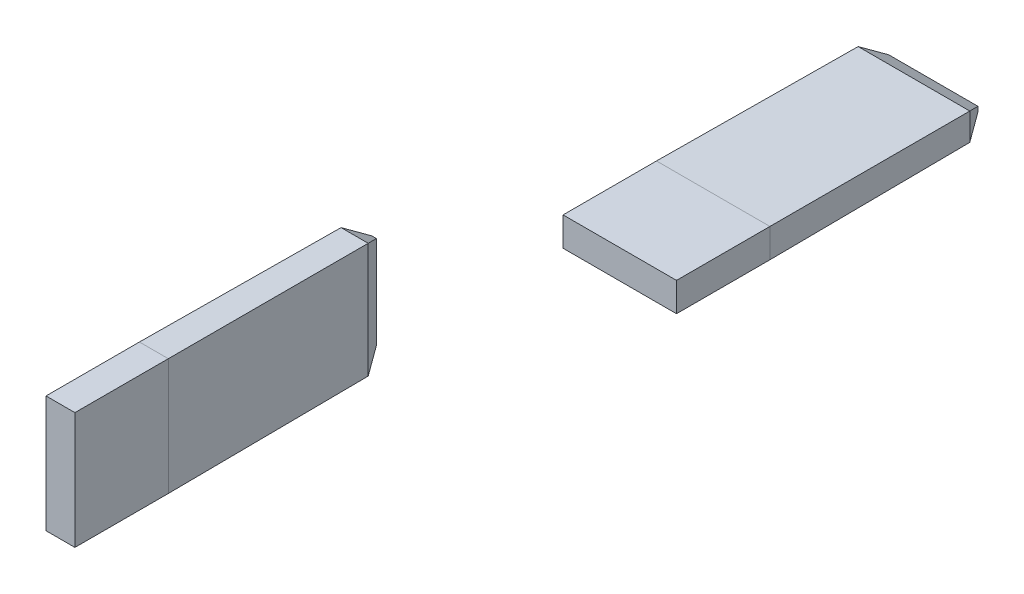
from build123d import *

# Parameters (mm, degrees)
SHIMS_TOP_START          = -1.6
SHIMS_SKETCH_W           = 2.6
SHIMS_SKETCH_H           = 10.5
SHIMS_TOP_DEPTH          = 8.4
SHIMS_SKETCH_W_2         = 10.2
SHIMS_SKETCH_H_2         = 2.6
SHIMS_TOP_2_DEPTH        = 8.4
SHIMS_BOTTOM_OUTLINE_W   = 10.027211308
SHIMS_BOTTOM_OUTLINE_H   = 2.427211308
SHIMS_BOTTOM_DEPTH       = 19.8
SHIMS_BOTTOM_DRAFT       = -0.25
SHIMS_BOTTOM_2_OUTLINE_W = 2.427211308
SHIMS_BOTTOM_2_OUTLINE_H = 10.327211308
SHIMS_BOTTOM_2_DEPTH     = 19.8
SHIMS_BOTTOM_2_DRAFT     = -0.25
CHAMFER1_SIZE            = 1
CHAMFER1_SIZE2           = 1.745257156
CHAMFER2_SIZE            = 1
CHAMFER2_SIZE2           = 1.745257156


# Read off the part's stored shape, not the designer's step: shims_bottom
with BuildPart() as part:
    # shims_sketch → shims_top (new body)
    with BuildSketch(Plane.XY.offset(SHIMS_TOP_START)):
        with Locations((-293.15, 0)):
            Rectangle(SHIMS_SKETCH_W, SHIMS_SKETCH_H)
    extrude(amount=-SHIMS_TOP_DEPTH)


with BuildPart() as body_2:
    # shims_sketch → shims_top 2 (new body)
    with BuildSketch(Plane.XY.offset(SHIMS_TOP_START)):
        with Locations((-242.85, 41.3)):
            Rectangle(SHIMS_SKETCH_W_2, SHIMS_SKETCH_H_2)
    extrude(amount=-SHIMS_TOP_2_DEPTH)


with BuildPart() as shims_bottom_tool:
    # shims_bottom outline → shims_bottom (with draft: the straight prism first)
    with BuildSketch(Plane.XY.offset(-29.8)):
        with Locations((-242.85, 41.3)):
            Rectangle(SHIMS_BOTTOM_OUTLINE_W, SHIMS_BOTTOM_OUTLINE_H)
    extrude(amount=SHIMS_BOTTOM_DEPTH)
    # shims_bottom: the draft: its side faces are tilted about the plane it starts from
    shims_bottom_sides = [shims_bottom_tool.faces().sort_by_distance(p)[0] for p in [
        (-242.85, 40.086394346, -19.9),
        (-237.836394346, 41.3, -19.9),
        (-242.85, 42.513605654, -19.9),
        (-247.863605654, 41.3, -19.9),
    ]]
    draft(shims_bottom_sides, Plane.XY.offset(-29.8), SHIMS_BOTTOM_DRAFT)


with BuildPart() as part_1:
    add(part.part)

    # shims_bottom: add shims_bottom_tool
    add(shims_bottom_tool.part)

    add(body_2.part)  # shims_bottom merges body 2


with BuildPart() as shims_bottom_2_tool:
    # shims_bottom 2 outline → shims_bottom 2 (with draft: the straight prism first)
    with BuildSketch(Plane.XY.offset(-29.8)):
        with Locations((-293.15, 0)):
            Rectangle(SHIMS_BOTTOM_2_OUTLINE_W, SHIMS_BOTTOM_2_OUTLINE_H)
    extrude(amount=SHIMS_BOTTOM_2_DEPTH)
    # shims_bottom 2: the draft: its side faces are tilted about the plane it starts from
    shims_bottom_2_sides = [shims_bottom_2_tool.faces().sort_by_distance(p)[0] for p in [
        (-293.15, -5.163605654, -19.9),
        (-291.936394346, 0, -19.9),
        (-293.15, 5.163605654, -19.9),
        (-294.363605654, 0, -19.9),
    ]]
    draft(shims_bottom_2_sides, Plane.XY.offset(-29.8), SHIMS_BOTTOM_2_DRAFT)


with BuildPart() as part_2:
    add(part_1.part)

    # shims_bottom 2: add shims_bottom_2_tool
    add(shims_bottom_2_tool.part)

    # Chamfer1
    chamfer1_edges = [part_2.edges().sort_by_distance(p)[0] for p in [
        (-293.15, -5.163605654, -29.8),
        (-291.936394346, 0, -29.8),
        (-293.15, 5.163605654, -29.8),
        (-294.363605654, 0, -29.8),
    ]]
    chamfer1_side = [part_2.faces().sort_by_distance(p)[0] for p in [
        (-293.15, 0, -29.8),
    ]]
    chamfer(chamfer1_edges, length=CHAMFER1_SIZE, length2=CHAMFER1_SIZE2, reference=chamfer1_side[0])

    # Chamfer2
    chamfer2_edges = [part_2.edges().sort_by_distance(p)[0] for p in [
        (-237.836394346, 41.3, -29.8),
        (-242.85, 42.513605654, -29.8),
        (-247.863605654, 41.3, -29.8),
        (-242.85, 40.086394346, -29.8),
    ]]
    chamfer2_side = [part_2.faces().sort_by_distance(p)[0] for p in [
        (-242.85, 41.3, -29.8),
    ]]
    chamfer(chamfer2_edges, length=CHAMFER2_SIZE, length2=CHAMFER2_SIZE2, reference=chamfer2_side[0])


solid = part_2.part
